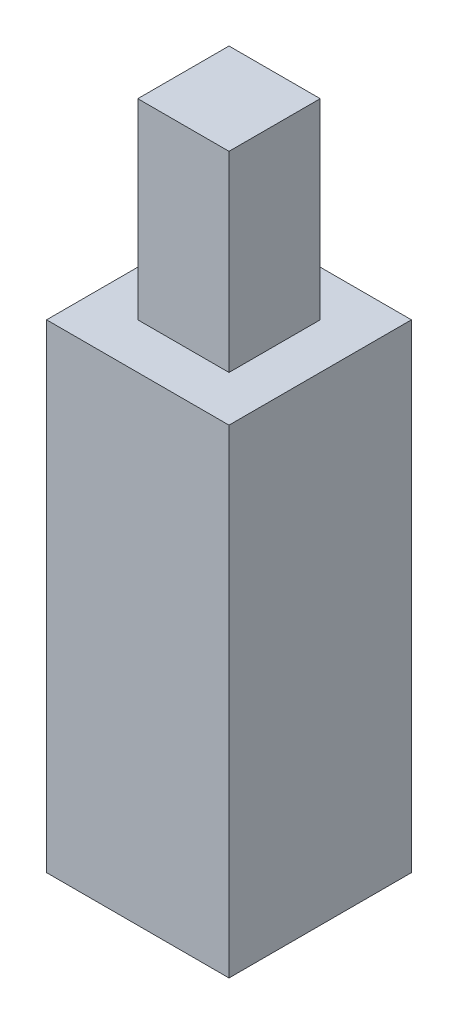
from build123d import *

# Parameters (mm, degrees)
SKETCH1_W           = 7.62
SKETCH1_H           = 7.62
BOSS_EXTRUDE1_DEPTH = 20
SKETCH2_W           = 3.81
SKETCH2_H           = 3.81
BOSS_EXTRUDE2_DEPTH = 8
SKETCH3_W           = 6.35
SKETCH3_H           = 6.35
CUT_EXTRUDE1_DEPTH  = 1.016


with BuildPart() as part:
    # Sketch1 → Boss-Extrude1 (new body)
    with BuildSketch(Plane(origin=(0, 0, 0), x_dir=(1, 0, 0), z_dir=(0, 1, 0))):
        with Locations((3.81, 3.81)):
            Rectangle(SKETCH1_W, SKETCH1_H)
    extrude(amount=BOSS_EXTRUDE1_DEPTH)

    # Sketch2 → Boss-Extrude2 (add)
    with BuildSketch(Plane(origin=(0, 20, 0), x_dir=(1, 0, 0), z_dir=(0, 1, 0))):
        with Locations((3.81, 3.81)):
            Rectangle(SKETCH2_W, SKETCH2_H)
    extrude(amount=BOSS_EXTRUDE2_DEPTH)

    # Sketch3 → Cut-Extrude1 (cut)
    with BuildSketch(Plane(origin=(0, 0, 0), x_dir=(-1, 0, 0), z_dir=(0, -1, 0))):
        with Locations((-3.81, 3.81)):
            Rectangle(SKETCH3_W, SKETCH3_H)
    extrude(amount=-CUT_EXTRUDE1_DEPTH, mode=Mode.SUBTRACT)


solid = part.part
